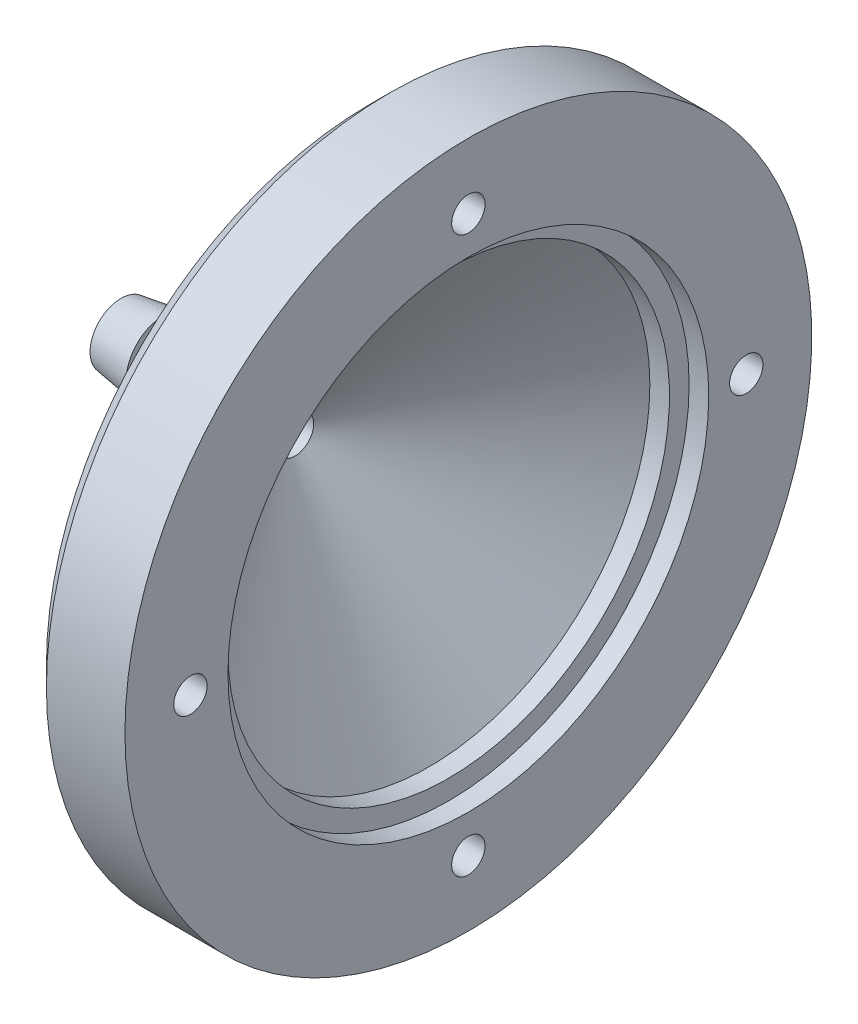
from build123d import *

# Parameters (mm, degrees)
M3_CLEARANCE_HOLE1_D     = 3.4
M3_CLEARANCE_HOLE1_DEPTH = 10
M3_CLEARANCE_HOLE1_TIP   = 1.021463052
CHAMFER1_SIZE            = 2


with BuildPart() as part:
    # Sketch1 → Revolve17 (revolve)
    with BuildSketch(Plane.XY):
        Polygon((-13.406349246, 3.8), (-13.406349246, 3.15), (-9.073015913, 3.8), (-9.073015913, 3.15), (-4.73968258, 3.8), (7.664494136, 22.5), (7.664494136, 35), (17.664494136, 35), (17.664494136, 24.5), (15.664494136, 24.5), (15.664494136, 22.5), (13.664494136, 22.5), (0, 1.9), (-17.73968258, 1.9), (-17.73968258, 3.15), align=None)
    revolve(axis=Axis((-801.920554309, 0, 0), (1, 0, 0)))

    # M3 Clearance Hole1
    with Locations(Plane.ZY.offset(-7.664494136)):
        with Locations((0, -28.325), (0, 28.325), (28.325, 0), (-28.325, 0)):
            Hole(M3_CLEARANCE_HOLE1_D / 2, depth=M3_CLEARANCE_HOLE1_DEPTH)
            with Locations((0, 0, -(M3_CLEARANCE_HOLE1_DEPTH + M3_CLEARANCE_HOLE1_TIP / 2))):  # 118° drill point
                Cone(0, M3_CLEARANCE_HOLE1_D / 2, M3_CLEARANCE_HOLE1_TIP, mode=Mode.SUBTRACT)

    # Chamfer1
    chamfer1_edges = [part.edges().sort_by_distance(p)[0] for p in [
        (7.664494136, -35, 0),
    ]]
    chamfer(chamfer1_edges, length=CHAMFER1_SIZE)


solid = part.part
